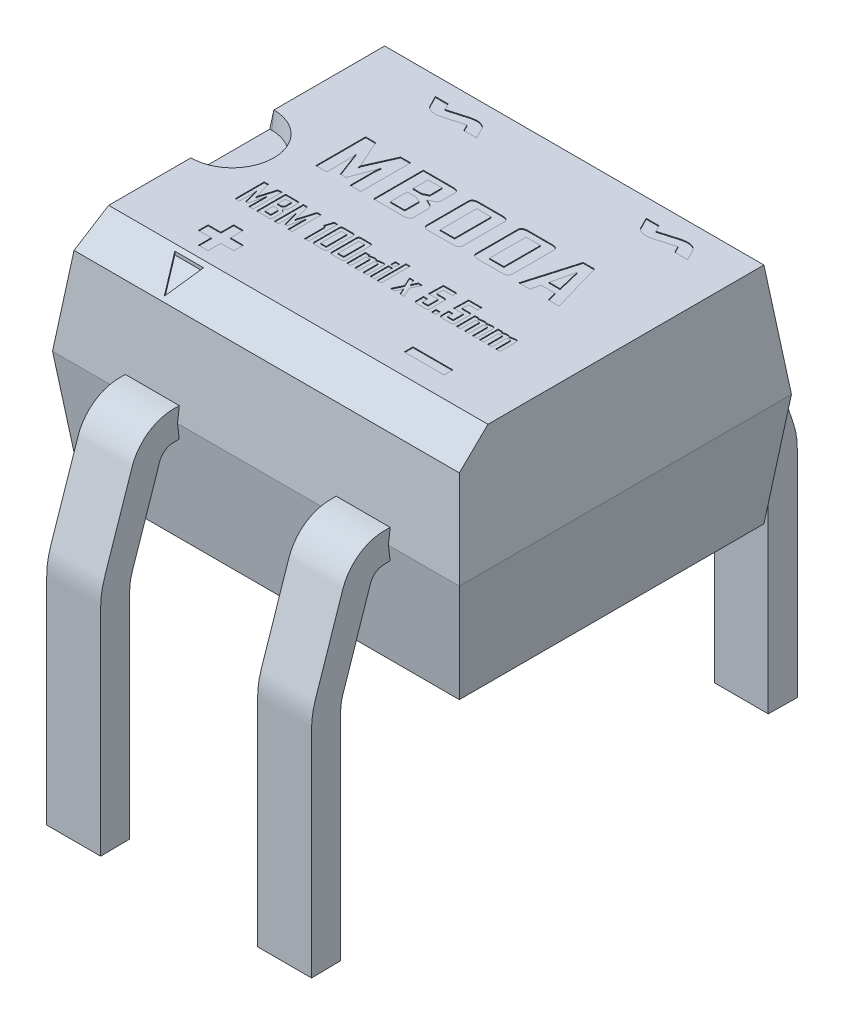
from build123d import *
from OCP.BRepFilletAPI import BRepFilletAPI_MakeChamfer

# Parameters (mm, degrees)
BODY_SKETCH_W                      = 4.9
BODY_SKETCH_H                      = 4
BODY_MAIN_DEPTH                    = 2.7
BODY_CHAMFER1_SIZE                 = 1.35
BODY_CHAMFER1_SIZE2                = 0.165759157
BODY_CHAMFER2_SIZE                 = 0.165759157
BODY_CHAMFER2_SIZE_2               = 1.35
BODY_CHAMFER_SIZE                  = 0.3
BODY_CHAMFER_SIZE2                 = 0.344559539
POLARITY_MARK_DEPTH                = 0.2
POLARITY_MARK_DRAFT                = -7
PIN_B_SKETCH_W                     = 0.65
PIN_B_SKETCH_H                     = 0.35
PIN_PATTERN_COUNT                  = 2
PIN_PATTERN_PITCH                  = 2.54
PIN_PATTERN_MIRROR_COPY_1_SKETCH_W = 0.65
PIN_PATTERN_MIRROR_COPY_1_SKETCH_H = 0.35
TEXT_START                         = 2.79
TEXT_2_OUTLINE_W                   = 0.173493975
TEXT_2_OUTLINE_H                   = 0.440963855
TEXT_2_OUTLINE_W_2                 = 0.173493976
TEXT_2_OUTLINE_W_3                 = 0.067469879
TEXT_2_OUTLINE_H_2                 = 0.248795181
TEXT_2_OUTLINE_W_4                 = 0.06746988
TEXT_2_OUTLINE_W_5                 = 0.050602409
TEXT_2_OUTLINE_H_3                 = 0.054819277
TEXT_2_OUTLINE_W_6                 = 0.05060241
TEXT_2_OUTLINE_H_4                 = 0.35
TEXT_2_OUTLINE_H_5                 = 0.223493976
TEXT_2_OUTLINE_W_7                 = 0.05152485
TEXT_2_DEPTH                       = 0.01
SKETCH23_W                         = 0.481927711
SKETCH23_H                         = 0.106024097
TEXT1_DEPTH                        = 0.01
PIN1_MARK_REACH                    = 10.714


# Read off the part's stored shape, not the designer's step: text
with BuildPart() as part:
    # BODY_Sketch → BODY_MAIN (new body)
    with BuildSketch(Plane(origin=(0, 0.1, 0), x_dir=(1, 0, 0), z_dir=(0, 1, 0))):
        with Locations((1.27, 2.75)):
            Rectangle(BODY_SKETCH_W, BODY_SKETCH_H)
    extrude(amount=BODY_MAIN_DEPTH)

    # BODY_Chamfer1: one chamfer whose edges measure the first distance from different faces: ONE call of the kernel's chamfer builder (chamfer() names one face for all edges)
    body_chamfer1_edges_1 = [part.edges().sort_by_distance(p)[0] for p in [
        (3.72, 2.8, -2.75),
    ]]
    body_chamfer1_side_1 = [part.faces().sort_by_distance(p)[0] for p in [
        (3.72, 1.45, -2.75),
    ]]
    body_chamfer1_edges_2 = [part.edges().sort_by_distance(p)[0] for p in [
        (1.27, 2.8, -4.75),
    ]]
    body_chamfer1_side_2 = [part.faces().sort_by_distance(p)[0] for p in [
        (1.27, 1.45, -4.75),
    ]]
    body_chamfer1_edges_3 = [part.edges().sort_by_distance(p)[0] for p in [
        (-1.18, 2.8, -2.75),
    ]]
    body_chamfer1_side_3 = [part.faces().sort_by_distance(p)[0] for p in [
        (-1.18, 1.45, -2.75),
    ]]
    body_chamfer1_edges_4 = [part.edges().sort_by_distance(p)[0] for p in [
        (1.27, 2.8, -0.75),
    ]]
    body_chamfer1_side_4 = [part.faces().sort_by_distance(p)[0] for p in [
        (1.27, 1.45, -0.75),
    ]]
    body_chamfer1 = BRepFilletAPI_MakeChamfer(part.part.solid().wrapped)
    for e in body_chamfer1_edges_1:
        body_chamfer1.Add(BODY_CHAMFER1_SIZE, BODY_CHAMFER1_SIZE2, e.wrapped, body_chamfer1_side_1[0].wrapped)  # the first distance lies on this face
    for e in body_chamfer1_edges_2:
        body_chamfer1.Add(BODY_CHAMFER1_SIZE, BODY_CHAMFER1_SIZE2, e.wrapped, body_chamfer1_side_2[0].wrapped)  # the first distance lies on this face
    for e in body_chamfer1_edges_3:
        body_chamfer1.Add(BODY_CHAMFER1_SIZE, BODY_CHAMFER1_SIZE2, e.wrapped, body_chamfer1_side_3[0].wrapped)  # the first distance lies on this face
    for e in body_chamfer1_edges_4:
        body_chamfer1.Add(BODY_CHAMFER1_SIZE, BODY_CHAMFER1_SIZE2, e.wrapped, body_chamfer1_side_4[0].wrapped)  # the first distance lies on this face
    add(Compound.cast(body_chamfer1.Shape()), mode=Mode.REPLACE)

    # BODY_Chamfer2
    # the kernel refuses this chamfer: 1.35, 0.165759157 mm, written as the material it takes off along each edge
    with BuildSketch(Plane(origin=(7.2290323, 0.1, -0.75), x_dir=(0, -0.2969684037613583, -0.9548873060039237), z_dir=(-1, 0, 0))) as body_chamfer2_piece_1:
        Polygon((BODY_CHAMFER2_SIZE * 0.954887307265, -BODY_CHAMFER2_SIZE * 0.296968404154), (-BODY_CHAMFER2_SIZE_2 * 0.296968403761, -BODY_CHAMFER2_SIZE_2 * 0.954887306004), (0, 0), align=None)
    extrude(amount=11.918064599, mode=Mode.SUBTRACT)
    with BuildSketch(Plane(origin=(3.72, 0.1, -8.2590323), x_dir=(-0.9548873060039239, -0.2969684037613578, 0), z_dir=(0, 0, 1))) as body_chamfer2_piece_2:
        Polygon((BODY_CHAMFER2_SIZE * 0.954887307265, -BODY_CHAMFER2_SIZE * 0.296968404154), (-BODY_CHAMFER2_SIZE_2 * 0.296968403761, -BODY_CHAMFER2_SIZE_2 * 0.954887306004), (0, 0), align=None)
    extrude(amount=11.018064599, mode=Mode.SUBTRACT)
    with BuildSketch(Plane(origin=(-4.6890323, 0.1, -4.75), x_dir=(0, 0.9999890085715016, -0.004688575069791045), z_dir=(1, 0, 0))) as body_chamfer2_piece_3:
        Polygon((BODY_CHAMFER2_SIZE_2 * 0.999989008572, BODY_CHAMFER2_SIZE_2 * 0.00468857506979), (-BODY_CHAMFER2_SIZE * 0.00468857507598, BODY_CHAMFER2_SIZE * 0.999989009892), (0, 0), align=None)
    extrude(amount=11.918064599, mode=Mode.SUBTRACT)
    with BuildSketch(Plane(origin=(-1.18, 0.1, 2.7590323), x_dir=(-0.004688575069790886, 0.9999890085715016, 0), z_dir=(0, 0, -1))) as body_chamfer2_piece_4:
        Polygon((BODY_CHAMFER2_SIZE_2 * 0.999989008572, BODY_CHAMFER2_SIZE_2 * 0.00468857506979), (-BODY_CHAMFER2_SIZE * 0.00468857507598, BODY_CHAMFER2_SIZE * 0.999989009892), (0, 0), align=None)
    extrude(amount=11.018064599, mode=Mode.SUBTRACT)

    # BODY_Chamfer
    body_chamfer_edges = [part.edges().sort_by_distance(p)[0] for p in [
        (1.27, 2.8, -0.915759157),
    ]]
    body_chamfer_side = [part.faces().sort_by_distance(p)[0] for p in [
        (1.27, 2.117122114, -0.831912296),
    ]]
    chamfer(body_chamfer_edges, length=BODY_CHAMFER_SIZE, length2=BODY_CHAMFER_SIZE2, reference=body_chamfer_side[0])


with BuildPart() as polarity_mark_tool:
    # Sketch24 → Polarity_mark (with draft: the straight prism first)
    with BuildSketch(Plane(origin=(0, 2.8, 0), x_dir=(1, 0, 0), z_dir=(0, 1, 0))):
        with BuildLine():
            ThreePointArc((-1.014240843, 2.25), (-0.514240843, 2.75), (-1.014240843, 3.25))
            Line((-1.014240843, 3.25), (-1.514240843, 3.25))
            Line((-1.514240843, 3.25), (-1.514240843, 2.25))
            Line((-1.514240843, 2.25), (-1.014240843, 2.25))
        make_face()
    extrude(amount=-POLARITY_MARK_DEPTH)
    # Polarity_mark: the draft: its side faces are tilted about the plane it starts from
    polarity_mark_sides = [polarity_mark_tool.faces().sort_by_distance(p)[0] for p in [
        (-0.514240843, 2.7, -2.75),
        (-1.264240843, 2.7, -3.25),
        (-1.514240843, 2.7, -2.75),
        (-1.264240843, 2.7, -2.25),
    ]]
    draft(polarity_mark_sides, Plane(origin=(0, 2.8, 0), x_dir=(1, 0, 0), z_dir=(0, 1, 0)), POLARITY_MARK_DRAFT)


with BuildPart() as part_1:
    add(part.part)

    # Polarity_mark: cut by polarity_mark_tool
    add(polarity_mark_tool.part, mode=Mode.SUBTRACT)

    # PIN: sweep along a path in PIN_B_Path
    with BuildLine(Plane(origin=(0, 0, 0), x_dir=(0, 0, -1), z_dir=(1, 0, 0))) as pin_path:
        Line((0, -2.6), (0, 0))
        ThreePointArc((0, 0), (0.009154664, 0.11283936), (0.036379203, 0.222727273))
        Line((0.036379203, 0.222727273), (0.368189602, 1.211363636))
        ThreePointArc((0.368189602, 1.211363636), (0.495644027, 1.384145449), (0.7, 1.45))
        Line((0.7, 1.45), (2.75, 1.45))
    # PIN_B_Sketch → PIN (sweep)
    with BuildSketch(Plane.XZ.offset(-0.01)):
        Rectangle(PIN_B_SKETCH_W, PIN_B_SKETCH_H)
    pin = sweep(path=pin_path.line)

    # PIN_Pattern: PIN ×2
    with Locations(*[(i * PIN_PATTERN_PITCH, 0, 0) for i in range(1, PIN_PATTERN_COUNT)]):
        add(pin)

    # PIN_Pattern_Mirror: PIN across plane
    add(pin.mirror(Plane.XY.offset(-2.75)))

    # PIN_Pattern_Mirror copy 1: sweep along a path in PIN_Pattern_Mirror copy 1 path
    with BuildLine(Plane(origin=(2.54, 0, -5.5), x_dir=(0, 0, 1), z_dir=(1, 0, 0))) as pin_pattern_mirror_copy_1_path:
        Line((0, 2.6), (0, 0))
        ThreePointArc((0, 0), (0.009154664, -0.11283936), (0.036379203, -0.222727273))
        Line((0.036379203, -0.222727273), (0.368189602, -1.211363636))
        ThreePointArc((0.368189602, -1.211363636), (0.495644027, -1.384145449), (0.7, -1.45))
        Line((0.7, -1.45), (2.75, -1.45))
    # PIN_Pattern_Mirror copy 1 sketch → PIN_Pattern_Mirror copy 1 (sweep)
    with BuildSketch(Plane(origin=(2.54, 0.01, -5.5), x_dir=(1, 0, 0), z_dir=(0, -1, 0))):
        Rectangle(PIN_PATTERN_MIRROR_COPY_1_SKETCH_W, PIN_PATTERN_MIRROR_COPY_1_SKETCH_H)
    sweep(path=pin_pattern_mirror_copy_1_path.line)

    # text 2 outline → text 2 (cut)
    # profile 1 of 21: a face of its own
    with BuildSketch(Plane(origin=(0, 0, 0), x_dir=(1, 0, 0), z_dir=(0, 1, 0)).offset(TEXT_START)):
        with BuildLine():
            add(Edge.make_bspline(
                [(0.231204819, 3.219343023), (0.231291506, 3.223639288), (0.231481335, 3.233047374), (0.233285905, 3.248255928), (0.235705383, 3.265784938), (0.23800289, 3.278161769), (0.239224398, 3.284742119)],
                knots=[0, 0, 0, 0, 0.195301478, 0.427676852, 0.695714808, 1, 1, 1, 1], degree=3))
            Line((0.231204819, 3.219343023), (0.231204819, 2.92227977))
            Line((0.231204819, 2.92227977), (0.361325301, 2.92227977))
            Line((0.361325301, 2.92227977), (0.361325301, 3.52227977))
            Line((0.361325301, 3.52227977), (0.240240964, 3.52227977))
            Line((0.240240964, 3.52227977), (0.09374247, 3.192573444))
            add(Edge.make_bspline(
                [(0.090240964, 3.165465011), (0.090289314, 3.167236598), (0.090394529, 3.171091732), (0.091195478, 3.177371247), (0.092112487, 3.184667989), (0.093177057, 3.189831177), (0.09374247, 3.192573444)],
                knots=[0, 0, 0, 0, 0.19413449, 0.422454333, 0.693254547, 1, 1, 1, 1], degree=3))
            add(Edge.make_bspline(
                [(0.086739458, 3.192573444), (0.087150658, 3.19133919), (0.088177477, 3.188257103), (0.088859566, 3.18241507), (0.089686218, 3.17463068), (0.090042506, 3.168743985), (0.090240964, 3.165465011)],
                knots=[0, 0, 0, 0, 0.142095852, 0.354830918, 0.640631437, 1, 1, 1, 1], degree=3))
            Line((0.086739458, 3.192573444), (-0.059759036, 3.52227977))
            Line((-0.059759036, 3.52227977), (-0.180843373, 3.52227977))
            Line((-0.180843373, 3.52227977), (-0.180843373, 2.92227977))
            Line((-0.180843373, 2.92227977), (-0.050722892, 2.92227977))
            Line((-0.050722892, 2.92227977), (-0.050722892, 3.219343023))
            add(Edge.make_bspline(
                [(-0.058629518, 3.284742119), (-0.057414547, 3.278047897), (-0.055140181, 3.265516636), (-0.052668272, 3.247922949), (-0.051029119, 3.232815329), (-0.050818815, 3.223563143), (-0.050722892, 3.219343023)],
                knots=[0, 0, 0, 0, 0.309420385, 0.579220093, 0.808073296, 1, 1, 1, 1], degree=3))
            Line((-0.058629518, 3.284742119), (0.056694277, 2.980111095))
            Line((0.056694277, 2.980111095), (0.12435241, 2.980111095))
            Line((0.12435241, 2.980111095), (0.239224398, 3.284742119))
        make_face()
    # profile 2 of 21: a face of its own
    with BuildSketch(Plane(origin=(0, 0, 0), x_dir=(1, 0, 0), z_dir=(0, 1, 0)).offset(TEXT_START)):
        with BuildLine():
            add(Edge.make_bspline(
                [(2.672108434, 2.303196824), (2.677709215, 2.304425586), (2.688889827, 2.306878516), (2.700067396, 2.309345274), (2.705645708, 2.310576342)],
                knots=[0, 0, 0, 0, 0.500936953, 1, 1, 1, 1], degree=3))
            Line((2.672108434, 2.303196824), (2.672108434, 2.314793209))
            Line((2.672108434, 2.314793209), (2.621506024, 2.314793209))
            Line((2.621506024, 2.314793209), (2.621506024, 2.091299233))
            Line((2.621506024, 2.091299233), (2.672108434, 2.091299233))
            Line((2.672108434, 2.091299233), (2.672108434, 2.272097426))
            Line((2.672108434, 2.272097426), (2.718493976, 2.272624534))
            Line((2.718493976, 2.272624534), (2.718493976, 2.091299233))
            Line((2.718493976, 2.091299233), (2.769096386, 2.091299233))
            Line((2.769096386, 2.091299233), (2.769096386, 2.272097426))
            Line((2.769096386, 2.272097426), (2.815481928, 2.272624534))
            Line((2.815481928, 2.272624534), (2.815481928, 2.091299233))
            Line((2.815481928, 2.091299233), (2.866084337, 2.091299233))
            Line((2.866084337, 2.091299233), (2.866084337, 2.287185905))
            add(Edge.make_bspline(
                [(2.836566265, 2.314793209), (2.838835885, 2.314687977), (2.843135824, 2.314488607), (2.849150581, 2.313122804), (2.854279159, 2.31086065), (2.858549858, 2.307798736), (2.861904874, 2.303820347), (2.864266395, 2.298978678), (2.865715975, 2.293327858), (2.86595734, 2.289303408), (2.866084337, 2.287185905)],
                knots=[0, 0, 0, 0, 0.148290832, 0.280946377, 0.400455298, 0.512425211, 0.621411208, 0.736958176, 0.861597969, 1, 1, 1, 1], degree=3))
            add(Edge.make_bspline(
                [(2.800261672, 2.309785679), (2.803968788, 2.310535594), (2.810925073, 2.311942786), (2.820699986, 2.313535835), (2.829100539, 2.314536157), (2.834236162, 2.314712981), (2.836566265, 2.314793209)],
                knots=[0, 0, 0, 0, 0.309141697, 0.580094407, 0.809483008, 1, 1, 1, 1], degree=3))
            add(Edge.make_bspline(
                [(2.764418298, 2.302274384), (2.770394395, 2.303493799), (2.782355416, 2.305934432), (2.794289984, 2.308501299), (2.800261672, 2.309785679)],
                knots=[0, 0, 0, 0, 0.499630991, 1, 1, 1, 1], degree=3))
            add(Edge.make_bspline(
                [(2.739578313, 2.314793209), (2.741117691, 2.314759111), (2.744055292, 2.314694042), (2.748256732, 2.314099875), (2.752009951, 2.313113369), (2.755395077, 2.311816661), (2.758323059, 2.310006226), (2.76083295, 2.307825824), (2.762978922, 2.305276366), (2.763932283, 2.303288024), (2.764418298, 2.302274384)],
                knots=[0, 0, 0, 0, 0.156222728, 0.298120382, 0.429540729, 0.5496141, 0.664719661, 0.776938378, 0.886284968, 1, 1, 1, 1], degree=3))
            add(Edge.make_bspline(
                [(2.705645708, 2.310576342), (2.708891156, 2.311220549), (2.715098442, 2.312452668), (2.724026156, 2.313751539), (2.732094033, 2.314616278), (2.737182508, 2.314736571), (2.739578313, 2.314793209)],
                knots=[0, 0, 0, 0, 0.289803378, 0.554281819, 0.790142707, 1, 1, 1, 1], degree=3))
        make_face()
    # profile 3 of 21: a face of its own
    with BuildSketch(Plane(origin=(0, 0, 0), x_dir=(1, 0, 0), z_dir=(0, 1, 0)).offset(TEXT_START)):
        with BuildLine():
            add(Edge.make_bspline(
                [(2.393795181, 2.303196824), (2.399395962, 2.304425586), (2.410576574, 2.306878516), (2.421754143, 2.309345274), (2.427332455, 2.310576342)],
                knots=[0, 0, 0, 0, 0.500936953, 1, 1, 1, 1], degree=3))
            Line((2.393795181, 2.303196824), (2.393795181, 2.314793209))
            Line((2.393795181, 2.314793209), (2.343192771, 2.314793209))
            Line((2.343192771, 2.314793209), (2.343192771, 2.091299233))
            Line((2.343192771, 2.091299233), (2.393795181, 2.091299233))
            Line((2.393795181, 2.091299233), (2.393795181, 2.272097426))
            Line((2.393795181, 2.272097426), (2.440180723, 2.272624534))
            Line((2.440180723, 2.272624534), (2.440180723, 2.091299233))
            Line((2.440180723, 2.091299233), (2.490783133, 2.091299233))
            Line((2.490783133, 2.091299233), (2.490783133, 2.272097426))
            Line((2.490783133, 2.272097426), (2.537168675, 2.272624534))
            Line((2.537168675, 2.272624534), (2.537168675, 2.091299233))
            Line((2.537168675, 2.091299233), (2.587771084, 2.091299233))
            Line((2.587771084, 2.091299233), (2.587771084, 2.287185905))
            add(Edge.make_bspline(
                [(2.558253012, 2.314793209), (2.560522632, 2.314687977), (2.564822571, 2.314488607), (2.570837328, 2.313122804), (2.575965905, 2.31086065), (2.580236605, 2.307798736), (2.583591621, 2.303820347), (2.585953142, 2.298978678), (2.587402722, 2.293327858), (2.587644087, 2.289303408), (2.587771084, 2.287185905)],
                knots=[0, 0, 0, 0, 0.148290832, 0.280946377, 0.400455298, 0.512425211, 0.621411208, 0.736958176, 0.861597969, 1, 1, 1, 1], degree=3))
            add(Edge.make_bspline(
                [(2.521948419, 2.309785679), (2.525655535, 2.310535594), (2.53261182, 2.311942786), (2.542386733, 2.313535835), (2.550787286, 2.314536157), (2.555922909, 2.314712981), (2.558253012, 2.314793209)],
                knots=[0, 0, 0, 0, 0.309141697, 0.580094407, 0.809483008, 1, 1, 1, 1], degree=3))
            add(Edge.make_bspline(
                [(2.486105045, 2.302274384), (2.492081142, 2.303493799), (2.504042163, 2.305934432), (2.515976731, 2.308501299), (2.521948419, 2.309785679)],
                knots=[0, 0, 0, 0, 0.499630991, 1, 1, 1, 1], degree=3))
            add(Edge.make_bspline(
                [(2.46126506, 2.314793209), (2.462804438, 2.314759111), (2.465742039, 2.314694042), (2.469943479, 2.314099875), (2.473696698, 2.313113369), (2.477081824, 2.311816661), (2.480009806, 2.310006226), (2.482519697, 2.307825824), (2.484665669, 2.305276366), (2.485619029, 2.303288024), (2.486105045, 2.302274384)],
                knots=[0, 0, 0, 0, 0.156222728, 0.298120382, 0.429540729, 0.5496141, 0.664719661, 0.776938378, 0.886284968, 1, 1, 1, 1], degree=3))
            add(Edge.make_bspline(
                [(2.427332455, 2.310576342), (2.430577903, 2.311220549), (2.436785189, 2.312452668), (2.445712903, 2.313751539), (2.45378078, 2.314616278), (2.458869255, 2.314736571), (2.46126506, 2.314793209)],
                knots=[0, 0, 0, 0, 0.289803378, 0.554281819, 0.790142707, 1, 1, 1, 1], degree=3))
        make_face()
    # profile 4 of 21: a face of its own
    with BuildSketch(Plane(origin=(0, 0, 0), x_dir=(1, 0, 0), z_dir=(0, 1, 0)).offset(TEXT_START)):
        with BuildLine():
            add(Edge.make_bspline(
                [(2.305240964, 2.118906537), (2.30509211, 2.116809195), (2.304810958, 2.11284779), (2.303319198, 2.107325108), (2.301130324, 2.102522194), (2.297903318, 2.098636879), (2.294018003, 2.095409873), (2.289215089, 2.093220999), (2.283692407, 2.091729239), (2.279731002, 2.091448087), (2.27763366, 2.091299233)],
                knots=[0, 0, 0, 0, 0.143087679, 0.270260174, 0.38817721, 0.5, 0.61182279, 0.729739826, 0.856912321, 1, 1, 1, 1], degree=3))
            Line((2.305240964, 2.118906537), (2.305240964, 2.287185905))
            add(Edge.make_bspline(
                [(2.27763366, 2.314793209), (2.279731002, 2.314644355), (2.283692407, 2.314363203), (2.289215089, 2.312871443), (2.294018003, 2.31068257), (2.297903318, 2.307455563), (2.301130324, 2.303570248), (2.303319198, 2.298767335), (2.304810958, 2.293244652), (2.30509211, 2.289283247), (2.305240964, 2.287185905)],
                knots=[0, 0, 0, 0, 0.143087679, 0.270260174, 0.38817721, 0.5, 0.61182279, 0.729739826, 0.856912321, 1, 1, 1, 1], degree=3))
            Line((2.27763366, 2.314793209), (2.187168675, 2.314793209))
            Line((2.187168675, 2.314793209), (2.191385542, 2.390696824))
            Line((2.191385542, 2.390696824), (2.301024096, 2.390696824))
            Line((2.301024096, 2.390696824), (2.301024096, 2.441299233))
            Line((2.301024096, 2.441299233), (2.140783133, 2.441299233))
            Line((2.140783133, 2.441299233), (2.136566265, 2.264190799))
            Line((2.136566265, 2.264190799), (2.254638554, 2.264190799))
            Line((2.254638554, 2.264190799), (2.254638554, 2.141901643))
            Line((2.254638554, 2.141901643), (2.187168675, 2.141901643))
            Line((2.187168675, 2.141901643), (2.187168675, 2.205154655))
            Line((2.187168675, 2.205154655), (2.136566265, 2.205154655))
            Line((2.136566265, 2.205154655), (2.136566265, 2.118906537))
            add(Edge.make_bspline(
                [(2.164173569, 2.091299233), (2.162076227, 2.091448087), (2.158114822, 2.091729239), (2.15259214, 2.093220999), (2.147789226, 2.095409873), (2.143903911, 2.098636879), (2.140676905, 2.102522194), (2.138488031, 2.107325108), (2.136996271, 2.11284779), (2.136715119, 2.116809195), (2.136566265, 2.118906537)],
                knots=[0, 0, 0, 0, 0.143087679, 0.270260174, 0.38817721, 0.5, 0.61182279, 0.729739826, 0.856912321, 1, 1, 1, 1], degree=3))
            Line((2.164173569, 2.091299233), (2.27763366, 2.091299233))
        make_face()
    # profile 5 of 21: a face of its own
    with BuildSketch(Plane(origin=(0, 0, 0), x_dir=(1, 0, 0), z_dir=(0, 1, 0)).offset(TEXT_START)):
        with BuildLine():
            add(Edge.make_bspline(
                [(0.947590361, 2.969606577), (0.947284445, 2.965991116), (0.946697697, 2.959056662), (0.942851845, 2.949475874), (0.937128947, 2.941175697), (0.928968547, 2.934577764), (0.918959227, 2.929185858), (0.906787123, 2.92550327), (0.892641498, 2.923015525), (0.882504615, 2.922535371), (0.877108434, 2.92227977)],
                knots=[0, 0, 0, 0, 0.114098337, 0.218840581, 0.322174175, 0.429434412, 0.547100708, 0.679564678, 0.829422238, 1, 1, 1, 1], degree=3))
            Line((0.947590361, 2.969606577), (0.947590361, 3.144455975))
            add(Edge.make_bspline(
                [(0.917658133, 3.199237601), (0.920038354, 3.197563369), (0.924708631, 3.194278328), (0.930770246, 3.188493292), (0.935972486, 3.182283231), (0.940250262, 3.175659332), (0.943638946, 3.16853815), (0.945792566, 3.160889786), (0.947387523, 3.152842272), (0.947521859, 3.147288189), (0.947590361, 3.144455975)],
                knots=[0, 0, 0, 0, 0.133657493, 0.26225178, 0.383948145, 0.505447312, 0.623949121, 0.745003415, 0.869968602, 1, 1, 1, 1], degree=3))
            add(Edge.make_bspline(
                [(0.847628012, 3.233123143), (0.852816926, 3.230661378), (0.862510404, 3.226062521), (0.876199385, 3.21982837), (0.887743229, 3.214026587), (0.897592556, 3.209600305), (0.905257842, 3.20557222), (0.911213636, 3.202876453), (0.915091755, 3.20076116), (0.917019601, 3.199616672), (0.917658133, 3.199237601)],
                knots=[0, 0, 0, 0, 0.221425396, 0.413647727, 0.579844793, 0.719452514, 0.829810176, 0.913562231, 0.971370526, 1, 1, 1, 1], degree=3))
            add(Edge.make_bspline(
                [(0.915286145, 3.265653264), (0.914649465, 3.265270694), (0.912814472, 3.264168079), (0.909022669, 3.2622882), (0.903352458, 3.259589421), (0.895812028, 3.255994871), (0.886413488, 3.251448001), (0.875164204, 3.246046438), (0.862034317, 3.239811984), (0.852639141, 3.235449808), (0.847628012, 3.233123143)],
                knots=[0, 0, 0, 0, 0.029670614, 0.085514592, 0.168948945, 0.280647032, 0.419252386, 0.586121092, 0.779248325, 1, 1, 1, 1], degree=3))
            add(Edge.make_bspline(
                [(0.943072289, 3.31794995), (0.942976655, 3.315198362), (0.942790913, 3.309854219), (0.941601679, 3.302038025), (0.939226416, 3.294823084), (0.936371126, 3.287892996), (0.932310973, 3.281592697), (0.927579595, 3.275644916), (0.921844518, 3.270280194), (0.917508997, 3.267221486), (0.915286145, 3.265653264)],
                knots=[0, 0, 0, 0, 0.13337718, 0.259045492, 0.38137207, 0.500668247, 0.621144296, 0.743089369, 0.868280056, 1, 1, 1, 1], degree=3))
            Line((0.943072289, 3.31794995), (0.943072289, 3.474952962))
            add(Edge.make_bspline(
                [(0.874849398, 3.52227977), (0.88005801, 3.522024163), (0.889859295, 3.521543176), (0.903550732, 3.51904247), (0.915364691, 3.515383414), (0.925046361, 3.509945713), (0.932975239, 3.503375534), (0.938442993, 3.495038082), (0.942158061, 3.485483864), (0.942758581, 3.478566539), (0.943072289, 3.474952962)],
                knots=[0, 0, 0, 0, 0.168128508, 0.316375143, 0.448176834, 0.565139626, 0.672821552, 0.776962353, 0.883486227, 1, 1, 1, 1], degree=3))
            Line((0.874849398, 3.52227977), (0.513855422, 3.52227977))
            Line((0.513855422, 3.52227977), (0.513855422, 2.92227977))
            Line((0.513855422, 2.92227977), (0.877108434, 2.92227977))
        make_face()
        Polygon((0.643975904, 2.994568926), (0.643975904, 3.196978565), (0.751054217, 3.196978565), (0.81746988, 3.167498143), (0.81746988, 2.994568926), align=None, mode=Mode.SUBTRACT)
        Polygon((0.812951807, 3.300781276), (0.748795181, 3.269267722), (0.643975904, 3.269267722), (0.643975904, 3.449990613), (0.812951807, 3.449990613), align=None, mode=Mode.SUBTRACT)
    # profile 6 of 21: a face of its own
    with BuildSketch(Plane(origin=(0, 0, 0), x_dir=(1, 0, 0), z_dir=(0, 1, 0)).offset(TEXT_START)):
        with BuildLine():
            add(Edge.make_bspline(
                [(1.541084337, 2.969606577), (1.540778421, 2.965991116), (1.540191673, 2.959056662), (1.536345821, 2.949475874), (1.530622923, 2.941175697), (1.522462523, 2.934577764), (1.512453203, 2.929185858), (1.500281099, 2.92550327), (1.486135474, 2.923015525), (1.47599859, 2.922535371), (1.47060241, 2.92227977)],
                knots=[0, 0, 0, 0, 0.114098337, 0.218840581, 0.322174175, 0.429434412, 0.547100708, 0.679564678, 0.829422238, 1, 1, 1, 1], degree=3))
            Line((1.541084337, 2.969606577), (1.541084337, 3.474952962))
            add(Edge.make_bspline(
                [(1.47060241, 3.52227977), (1.47599859, 3.522024169), (1.486135474, 3.521544015), (1.500281099, 3.51905627), (1.512453203, 3.515373681), (1.522462523, 3.509981776), (1.530622923, 3.503383842), (1.536345821, 3.495083665), (1.540191673, 3.485502877), (1.540778421, 3.478568424), (1.541084337, 3.474952962)],
                knots=[0, 0, 0, 0, 0.170577762, 0.320435322, 0.452899292, 0.570565588, 0.677825825, 0.781159419, 0.885901663, 1, 1, 1, 1], degree=3))
            Line((1.47060241, 3.52227977), (1.179525602, 3.52227977))
            add(Edge.make_bspline(
                [(1.107349398, 3.474952962), (1.107645074, 3.478572224), (1.108213317, 3.485527875), (1.112216909, 3.495089628), (1.118048141, 3.50342938), (1.126444185, 3.509977645), (1.136665695, 3.515371701), (1.149130782, 3.51908346), (1.163620901, 3.521528426), (1.174017458, 3.522019563), (1.179525602, 3.52227977)],
                knots=[0, 0, 0, 0, 0.112348161, 0.215915455, 0.318343111, 0.425762474, 0.543690884, 0.676356302, 0.828532073, 1, 1, 1, 1], degree=3))
            Line((1.107349398, 3.474952962), (1.107349398, 2.969606577))
            add(Edge.make_bspline(
                [(1.177831325, 2.92227977), (1.172435145, 2.922535371), (1.162298261, 2.923015525), (1.148152636, 2.92550327), (1.135980532, 2.929185858), (1.125971212, 2.934577764), (1.117810812, 2.941175697), (1.112087914, 2.949475874), (1.108242062, 2.959056662), (1.107655314, 2.965991116), (1.107349398, 2.969606577)],
                knots=[0, 0, 0, 0, 0.170577762, 0.320435322, 0.452899292, 0.570565588, 0.677825825, 0.781159419, 0.885901663, 1, 1, 1, 1], degree=3))
            Line((1.177831325, 2.92227977), (1.47060241, 2.92227977))
        make_face()
        with Locations((1.324216868, 3.22227977)):
            Rectangle(TEXT_2_OUTLINE_W, TEXT_2_OUTLINE_H, mode=Mode.SUBTRACT)
    # profile 7 of 21: a face of its own
    with BuildSketch(Plane(origin=(0, 0, 0), x_dir=(1, 0, 0), z_dir=(0, 1, 0)).offset(TEXT_START)):
        with BuildLine():
            add(Edge.make_bspline(
                [(2.134578313, 2.969606577), (2.134272397, 2.965991116), (2.133685649, 2.959056662), (2.129839797, 2.949475874), (2.124116899, 2.941175697), (2.115956499, 2.934577764), (2.105947179, 2.929185858), (2.093775075, 2.92550327), (2.07962945, 2.923015525), (2.069492566, 2.922535371), (2.064096386, 2.92227977)],
                knots=[0, 0, 0, 0, 0.114098337, 0.218840581, 0.322174175, 0.429434412, 0.547100708, 0.679564678, 0.829422238, 1, 1, 1, 1], degree=3))
            Line((2.134578313, 2.969606577), (2.134578313, 3.474952962))
            add(Edge.make_bspline(
                [(2.064096386, 3.52227977), (2.069492566, 3.522024169), (2.07962945, 3.521544015), (2.093775075, 3.51905627), (2.105947179, 3.515373681), (2.115956499, 3.509981776), (2.124116899, 3.503383842), (2.129839797, 3.495083665), (2.133685649, 3.485502877), (2.134272397, 3.478568424), (2.134578313, 3.474952962)],
                knots=[0, 0, 0, 0, 0.170577762, 0.320435322, 0.452899292, 0.570565588, 0.677825825, 0.781159419, 0.885901663, 1, 1, 1, 1], degree=3))
            Line((2.064096386, 3.52227977), (1.773019578, 3.52227977))
            add(Edge.make_bspline(
                [(1.700843373, 3.474952962), (1.70113905, 3.478572224), (1.701707293, 3.485527875), (1.705710885, 3.495089628), (1.711542117, 3.50342938), (1.719938161, 3.509977645), (1.73015967, 3.515371701), (1.742624758, 3.51908346), (1.757114877, 3.521528426), (1.767511434, 3.522019563), (1.773019578, 3.52227977)],
                knots=[0, 0, 0, 0, 0.112348161, 0.215915455, 0.318343111, 0.425762474, 0.543690884, 0.676356302, 0.828532073, 1, 1, 1, 1], degree=3))
            Line((1.700843373, 3.474952962), (1.700843373, 2.969606577))
            add(Edge.make_bspline(
                [(1.771325301, 2.92227977), (1.76592912, 2.922535371), (1.755792237, 2.923015525), (1.741646612, 2.92550327), (1.729474508, 2.929185858), (1.719465188, 2.934577764), (1.711304788, 2.941175697), (1.70558189, 2.949475874), (1.701736038, 2.959056662), (1.70114929, 2.965991116), (1.700843373, 2.969606577)],
                knots=[0, 0, 0, 0, 0.170577762, 0.320435322, 0.452899292, 0.570565588, 0.677825825, 0.781159419, 0.885901663, 1, 1, 1, 1], degree=3))
            Line((1.771325301, 2.92227977), (2.064096386, 2.92227977))
        make_face()
        with Locations((1.917710843, 3.22227977)):
            Rectangle(TEXT_2_OUTLINE_W_2, TEXT_2_OUTLINE_H, mode=Mode.SUBTRACT)
    # profile 8 of 21: a face of its own
    with BuildSketch(Plane(origin=(0, 0, 0), x_dir=(1, 0, 0), z_dir=(0, 1, 0)).offset(TEXT_START)):
        with BuildLine():
            add(Edge.make_bspline(
                [(-0.157409639, 2.264586131), (-0.157365916, 2.267090873), (-0.157270321, 2.272567312), (-0.156598736, 2.281439245), (-0.155723913, 2.291663392), (-0.154802312, 2.298895066), (-0.154312877, 2.302735604)],
                knots=[0, 0, 0, 0, 0.196205167, 0.428988559, 0.69675201, 1, 1, 1, 1], degree=3))
            Line((-0.157409639, 2.264586131), (-0.157409639, 2.091299233))
            Line((-0.157409639, 2.091299233), (-0.106807229, 2.091299233))
            Line((-0.106807229, 2.091299233), (-0.106807229, 2.441299233))
            Line((-0.106807229, 2.441299233), (-0.156355422, 2.441299233))
            Line((-0.156355422, 2.441299233), (-0.21295369, 2.248970543))
            add(Edge.make_bspline(
                [(-0.214337349, 2.23315729), (-0.214326502, 2.234189989), (-0.214302931, 2.236434083), (-0.214006036, 2.240103979), (-0.213537045, 2.244340312), (-0.213155624, 2.247367738), (-0.21295369, 2.248970543)],
                knots=[0, 0, 0, 0, 0.194996564, 0.423734939, 0.69490896, 1, 1, 1, 1], degree=3))
            add(Edge.make_bspline(
                [(-0.215721009, 2.248970543), (-0.215550612, 2.248248387), (-0.21512137, 2.24642923), (-0.214917945, 2.243038688), (-0.214536887, 2.238500582), (-0.214408757, 2.235069471), (-0.214337349, 2.23315729)],
                knots=[0, 0, 0, 0, 0.139830187, 0.352241267, 0.63899967, 1, 1, 1, 1], degree=3))
            Line((-0.215721009, 2.248970543), (-0.272319277, 2.441299233))
            Line((-0.272319277, 2.441299233), (-0.32186747, 2.441299233))
            Line((-0.32186747, 2.441299233), (-0.32186747, 2.091299233))
            Line((-0.32186747, 2.091299233), (-0.27126506, 2.091299233))
            Line((-0.27126506, 2.091299233), (-0.27126506, 2.264586131))
            add(Edge.make_bspline(
                [(-0.274427711, 2.302735604), (-0.273947898, 2.298828222), (-0.273048546, 2.291504294), (-0.272066062, 2.281244755), (-0.271407929, 2.272435357), (-0.27130985, 2.267046866), (-0.27126506, 2.264586131)],
                knots=[0, 0, 0, 0, 0.308334773, 0.577937301, 0.807258736, 1, 1, 1, 1], degree=3))
            Line((-0.274427711, 2.302735604), (-0.227910392, 2.125034173))
            Line((-0.227910392, 2.125034173), (-0.200566642, 2.125034173))
            Line((-0.200566642, 2.125034173), (-0.154312877, 2.302735604))
        make_face()
    # profile 9 of 21: a face of its own
    with BuildSketch(Plane(origin=(0, 0, 0), x_dir=(1, 0, 0), z_dir=(0, 1, 0)).offset(TEXT_START)):
        with BuildLine():
            add(Edge.make_bspline(
                [(0.108253012, 2.118906537), (0.108104158, 2.116809195), (0.107823006, 2.11284779), (0.106331246, 2.107325108), (0.104142373, 2.102522194), (0.100915366, 2.098636879), (0.097030051, 2.095409873), (0.092227138, 2.093220999), (0.086704455, 2.091729239), (0.08274305, 2.091448087), (0.080645708, 2.091299233)],
                knots=[0, 0, 0, 0, 0.143087679, 0.270260174, 0.38817721, 0.5, 0.61182279, 0.729739826, 0.856912321, 1, 1, 1, 1], degree=3))
            Line((0.108253012, 2.118906537), (0.108253012, 2.216685152))
            add(Edge.make_bspline(
                [(0.096590738, 2.248641101), (0.098381025, 2.24657968), (0.101994391, 2.242419081), (0.105675469, 2.234750172), (0.107894179, 2.22605704), (0.108129678, 2.219906356), (0.108253012, 2.216685152)],
                knots=[0, 0, 0, 0, 0.233880582, 0.472044868, 0.723502121, 1, 1, 1, 1], degree=3))
            add(Edge.make_bspline(
                [(0.069444654, 2.268407667), (0.071459556, 2.266972133), (0.075221178, 2.264292133), (0.08057577, 2.260652975), (0.084985722, 2.257265752), (0.08885765, 2.254680158), (0.091776783, 2.2523315), (0.094145204, 2.250760864), (0.095627558, 2.249526289), (0.09635035, 2.248862023), (0.096590738, 2.248641101)],
                knots=[0, 0, 0, 0, 0.220942432, 0.412477611, 0.578026926, 0.717341328, 0.827964795, 0.912327655, 0.970841742, 1, 1, 1, 1], degree=3))
            add(Edge.make_bspline(
                [(0.095734187, 2.28738357), (0.095496398, 2.287159318), (0.094801128, 2.286503629), (0.093264116, 2.285462327), (0.091082396, 2.283842699), (0.088169292, 2.281721615), (0.084491431, 2.279131143), (0.080152624, 2.275915354), (0.075018364, 2.272345783), (0.07137554, 2.269771939), (0.069444654, 2.268407667)],
                knots=[0, 0, 0, 0, 0.03020373, 0.088312421, 0.171215672, 0.28175334, 0.42157366, 0.587380162, 0.781289977, 1, 1, 1, 1], degree=3))
            add(Edge.make_bspline(
                [(0.106474021, 2.317889971), (0.106371703, 2.31477788), (0.106176865, 2.308851753), (0.104053205, 2.300536825), (0.100789468, 2.293187886), (0.097396075, 2.289291699), (0.095734187, 2.28738357)],
                knots=[0, 0, 0, 0, 0.28088772, 0.534874023, 0.772208062, 1, 1, 1, 1], degree=3))
            Line((0.106474021, 2.317889971), (0.106474021, 2.413691929))
            add(Edge.make_bspline(
                [(0.079723268, 2.441299233), (0.081753647, 2.441147192), (0.085604393, 2.440858835), (0.090971664, 2.439400327), (0.095597943, 2.437139624), (0.099420969, 2.434006235), (0.10239804, 2.430003529), (0.10464915, 2.425293993), (0.106016698, 2.41973581), (0.106315565, 2.41578605), (0.106474021, 2.413691929)],
                knots=[0, 0, 0, 0, 0.140831718, 0.267096601, 0.382794658, 0.495223805, 0.606013682, 0.725812601, 0.85462873, 1, 1, 1, 1], degree=3))
            Line((0.079723268, 2.441299233), (-0.064638554, 2.441299233))
            Line((-0.064638554, 2.441299233), (-0.064638554, 2.091299233))
            Line((-0.064638554, 2.091299233), (0.080645708, 2.091299233))
        make_face()
        Polygon((0.057650602, 2.141901643), (-0.014036145, 2.141901643), (-0.014036145, 2.243106462), (0.031624623, 2.243106462), (0.057650602, 2.228347426), align=None, mode=Mode.SUBTRACT)
        Polygon((-0.014036145, 2.390696824), (0.055871611, 2.390696824), (0.055871611, 2.31064223), (0.030768072, 2.293708872), (-0.014036145, 2.293708872), align=None, mode=Mode.SUBTRACT)
    # profile 10 of 21: a face of its own
    with BuildSketch(Plane(origin=(0, 0, 0), x_dir=(1, 0, 0), z_dir=(0, 1, 0)).offset(TEXT_START)):
        with BuildLine():
            add(Edge.make_bspline(
                [(0.314879518, 2.264586131), (0.31492324, 2.267090873), (0.315018835, 2.272567312), (0.315690421, 2.281439245), (0.316565244, 2.291663392), (0.317486844, 2.298895066), (0.31797628, 2.302735604)],
                knots=[0, 0, 0, 0, 0.196205167, 0.428988559, 0.69675201, 1, 1, 1, 1], degree=3))
            Line((0.314879518, 2.264586131), (0.314879518, 2.091299233))
            Line((0.314879518, 2.091299233), (0.365481928, 2.091299233))
            Line((0.365481928, 2.091299233), (0.365481928, 2.441299233))
            Line((0.365481928, 2.441299233), (0.315933735, 2.441299233))
            Line((0.315933735, 2.441299233), (0.259335467, 2.248970543))
            add(Edge.make_bspline(
                [(0.257951807, 2.23315729), (0.257962655, 2.234189989), (0.257986226, 2.236434083), (0.258283121, 2.240103979), (0.258752112, 2.244340312), (0.259133532, 2.247367738), (0.259335467, 2.248970543)],
                knots=[0, 0, 0, 0, 0.194996564, 0.423734939, 0.69490896, 1, 1, 1, 1], degree=3))
            add(Edge.make_bspline(
                [(0.256568148, 2.248970543), (0.256738545, 2.248248387), (0.257167787, 2.24642923), (0.257371212, 2.243038688), (0.257752269, 2.238500582), (0.257880399, 2.235069471), (0.257951807, 2.23315729)],
                knots=[0, 0, 0, 0, 0.139830187, 0.352241267, 0.63899967, 1, 1, 1, 1], degree=3))
            Line((0.256568148, 2.248970543), (0.19996988, 2.441299233))
            Line((0.19996988, 2.441299233), (0.150421687, 2.441299233))
            Line((0.150421687, 2.441299233), (0.150421687, 2.091299233))
            Line((0.150421687, 2.091299233), (0.201024096, 2.091299233))
            Line((0.201024096, 2.091299233), (0.201024096, 2.264586131))
            add(Edge.make_bspline(
                [(0.197861446, 2.302735604), (0.198341259, 2.298828222), (0.199240611, 2.291504294), (0.200223095, 2.281244755), (0.200881227, 2.272435357), (0.200979307, 2.267046866), (0.201024096, 2.264586131)],
                knots=[0, 0, 0, 0, 0.308334773, 0.577937301, 0.807258736, 1, 1, 1, 1], degree=3))
            Line((0.197861446, 2.302735604), (0.244378765, 2.125034173))
            Line((0.244378765, 2.125034173), (0.271722515, 2.125034173))
            Line((0.271722515, 2.125034173), (0.31797628, 2.302735604))
        make_face()
    # profile 11 of 21: a face of its own
    with BuildSketch(Plane(origin=(0, 0, 0), x_dir=(1, 0, 0), z_dir=(0, 1, 0)).offset(TEXT_START)):
        with BuildLine():
            add(Edge.make_bspline(
                [(2.001626506, 2.118906537), (2.001477652, 2.116809195), (2.0011965, 2.11284779), (1.99970474, 2.107325108), (1.997515866, 2.102522194), (1.99428886, 2.098636879), (1.990403545, 2.095409873), (1.985600632, 2.093220999), (1.980077949, 2.091729239), (1.976116544, 2.091448087), (1.974019202, 2.091299233)],
                knots=[0, 0, 0, 0, 0.143087679, 0.270260174, 0.38817721, 0.5, 0.61182279, 0.729739826, 0.856912321, 1, 1, 1, 1], degree=3))
            Line((2.001626506, 2.118906537), (2.001626506, 2.287185905))
            add(Edge.make_bspline(
                [(1.974019202, 2.314793209), (1.976116544, 2.314644355), (1.980077949, 2.314363203), (1.985600632, 2.312871443), (1.990403545, 2.31068257), (1.99428886, 2.307455563), (1.997515866, 2.303570248), (1.99970474, 2.298767335), (2.0011965, 2.293244652), (2.001477652, 2.289283247), (2.001626506, 2.287185905)],
                knots=[0, 0, 0, 0, 0.143087679, 0.270260174, 0.38817721, 0.5, 0.61182279, 0.729739826, 0.856912321, 1, 1, 1, 1], degree=3))
            Line((1.974019202, 2.314793209), (1.883554217, 2.314793209))
            Line((1.883554217, 2.314793209), (1.887771084, 2.390696824))
            Line((1.887771084, 2.390696824), (1.997409639, 2.390696824))
            Line((1.997409639, 2.390696824), (1.997409639, 2.441299233))
            Line((1.997409639, 2.441299233), (1.837168675, 2.441299233))
            Line((1.837168675, 2.441299233), (1.832951807, 2.264190799))
            Line((1.832951807, 2.264190799), (1.951024096, 2.264190799))
            Line((1.951024096, 2.264190799), (1.951024096, 2.141901643))
            Line((1.951024096, 2.141901643), (1.883554217, 2.141901643))
            Line((1.883554217, 2.141901643), (1.883554217, 2.205154655))
            Line((1.883554217, 2.205154655), (1.832951807, 2.205154655))
            Line((1.832951807, 2.205154655), (1.832951807, 2.118906537))
            add(Edge.make_bspline(
                [(1.860559111, 2.091299233), (1.858461769, 2.091448087), (1.854500364, 2.091729239), (1.848977682, 2.093220999), (1.844174768, 2.095409873), (1.840289454, 2.098636879), (1.837062447, 2.102522194), (1.834873573, 2.107325108), (1.833381813, 2.11284779), (1.833100661, 2.116809195), (1.832951807, 2.118906537)],
                knots=[0, 0, 0, 0, 0.143087679, 0.270260174, 0.38817721, 0.5, 0.61182279, 0.729739826, 0.856912321, 1, 1, 1, 1], degree=3))
            Line((1.860559111, 2.091299233), (1.974019202, 2.091299233))
        make_face()
    # profile 12 of 21: a face of its own
    with BuildSketch(Plane(origin=(0, 0, 0), x_dir=(1, 0, 0), z_dir=(0, 1, 0)).offset(TEXT_START)):
        with BuildLine():
            add(Edge.make_bspline(
                [(1.073915663, 2.303196824), (1.079516444, 2.304425586), (1.090697056, 2.306878516), (1.101874625, 2.309345274), (1.107452937, 2.310576342)],
                knots=[0, 0, 0, 0, 0.500936953, 1, 1, 1, 1], degree=3))
            Line((1.073915663, 2.303196824), (1.073915663, 2.314793209))
            Line((1.073915663, 2.314793209), (1.023313253, 2.314793209))
            Line((1.023313253, 2.314793209), (1.023313253, 2.091299233))
            Line((1.023313253, 2.091299233), (1.073915663, 2.091299233))
            Line((1.073915663, 2.091299233), (1.073915663, 2.272097426))
            Line((1.073915663, 2.272097426), (1.120301205, 2.272624534))
            Line((1.120301205, 2.272624534), (1.120301205, 2.091299233))
            Line((1.120301205, 2.091299233), (1.170903614, 2.091299233))
            Line((1.170903614, 2.091299233), (1.170903614, 2.272097426))
            Line((1.170903614, 2.272097426), (1.217289157, 2.272624534))
            Line((1.217289157, 2.272624534), (1.217289157, 2.091299233))
            Line((1.217289157, 2.091299233), (1.267891566, 2.091299233))
            Line((1.267891566, 2.091299233), (1.267891566, 2.287185905))
            add(Edge.make_bspline(
                [(1.238373494, 2.314793209), (1.240643114, 2.314687977), (1.244943052, 2.314488607), (1.25095781, 2.313122804), (1.256086387, 2.31086065), (1.260357087, 2.307798736), (1.263712103, 2.303820347), (1.266073624, 2.298978678), (1.267523204, 2.293327858), (1.267764569, 2.289303408), (1.267891566, 2.287185905)],
                knots=[0, 0, 0, 0, 0.148290832, 0.280946377, 0.400455298, 0.512425211, 0.621411208, 0.736958176, 0.861597969, 1, 1, 1, 1], degree=3))
            add(Edge.make_bspline(
                [(1.202068901, 2.309785679), (1.205776017, 2.310535594), (1.212732302, 2.311942786), (1.222507215, 2.313535835), (1.230907768, 2.314536157), (1.236043391, 2.314712981), (1.238373494, 2.314793209)],
                knots=[0, 0, 0, 0, 0.309141697, 0.580094407, 0.809483008, 1, 1, 1, 1], degree=3))
            add(Edge.make_bspline(
                [(1.166225527, 2.302274384), (1.172201624, 2.303493799), (1.184162645, 2.305934432), (1.196097213, 2.308501299), (1.202068901, 2.309785679)],
                knots=[0, 0, 0, 0, 0.499630991, 1, 1, 1, 1], degree=3))
            add(Edge.make_bspline(
                [(1.141385542, 2.314793209), (1.14292492, 2.314759111), (1.145862521, 2.314694042), (1.150063961, 2.314099875), (1.15381718, 2.313113369), (1.157202306, 2.311816661), (1.160130288, 2.310006226), (1.162640179, 2.307825824), (1.164786151, 2.305276366), (1.165739511, 2.303288024), (1.166225527, 2.302274384)],
                knots=[0, 0, 0, 0, 0.156222728, 0.298120382, 0.429540729, 0.5496141, 0.664719661, 0.776938378, 0.886284968, 1, 1, 1, 1], degree=3))
            add(Edge.make_bspline(
                [(1.107452937, 2.310576342), (1.110698384, 2.311220549), (1.116905671, 2.312452668), (1.125833385, 2.313751539), (1.133901262, 2.314616278), (1.138989737, 2.314736571), (1.141385542, 2.314793209)],
                knots=[0, 0, 0, 0, 0.289803378, 0.554281819, 0.790142707, 1, 1, 1, 1], degree=3))
        make_face()
    # profile 13 of 21: a face of its own
    with BuildSketch(Plane(origin=(0, 0, 0), x_dir=(1, 0, 0), z_dir=(0, 1, 0)).offset(TEXT_START)):
        with BuildLine():
            add(Edge.make_bspline(
                [(0.985361446, 2.118906537), (0.985212592, 2.116809195), (0.98493144, 2.11284779), (0.98343968, 2.107325108), (0.981250806, 2.102522194), (0.978023799, 2.098636879), (0.974138485, 2.095409873), (0.969335571, 2.093220999), (0.963812889, 2.091729239), (0.959851484, 2.091448087), (0.957754142, 2.091299233)],
                knots=[0, 0, 0, 0, 0.143087679, 0.270260174, 0.38817721, 0.5, 0.61182279, 0.729739826, 0.856912321, 1, 1, 1, 1], degree=3))
            Line((0.985361446, 2.118906537), (0.985361446, 2.413691929))
            add(Edge.make_bspline(
                [(0.957754142, 2.441299233), (0.959851484, 2.441150379), (0.963812889, 2.440869227), (0.969335571, 2.439377467), (0.974138485, 2.437188594), (0.978023799, 2.433961587), (0.981250806, 2.430076273), (0.98343968, 2.425273359), (0.98493144, 2.419750676), (0.985212592, 2.415789272), (0.985361446, 2.413691929)],
                knots=[0, 0, 0, 0, 0.143087679, 0.270260174, 0.38817721, 0.5, 0.61182279, 0.729739826, 0.856912321, 1, 1, 1, 1], degree=3))
            Line((0.957754142, 2.441299233), (0.845018825, 2.441299233))
            add(Edge.make_bspline(
                [(0.816686747, 2.413691929), (0.816829155, 2.415790792), (0.817098526, 2.419760881), (0.818677895, 2.425278943), (0.820930436, 2.430083352), (0.824226565, 2.433963413), (0.828190151, 2.437207912), (0.833133018, 2.439386551), (0.838810269, 2.44086022), (0.842878233, 2.44114787), (0.845018825, 2.441299233)],
                knots=[0, 0, 0, 0, 0.141223278, 0.267129934, 0.384156657, 0.495459119, 0.606977379, 0.726031612, 0.85583585, 1, 1, 1, 1], degree=3))
            Line((0.816686747, 2.413691929), (0.816686747, 2.118906537))
            add(Edge.make_bspline(
                [(0.844294051, 2.091299233), (0.842196709, 2.091448087), (0.838235304, 2.091729239), (0.832712621, 2.093220999), (0.827909708, 2.095409873), (0.824024393, 2.098636879), (0.820797387, 2.102522194), (0.818608513, 2.107325108), (0.817116753, 2.11284779), (0.816835601, 2.116809195), (0.816686747, 2.118906537)],
                knots=[0, 0, 0, 0, 0.143087679, 0.270260174, 0.38817721, 0.5, 0.61182279, 0.729739826, 0.856912321, 1, 1, 1, 1], degree=3))
            Line((0.844294051, 2.091299233), (0.957754142, 2.091299233))
        make_face()
        with Locations((0.901024097, 2.266299233)):
            Rectangle(TEXT_2_OUTLINE_W_3, TEXT_2_OUTLINE_H_2, mode=Mode.SUBTRACT)
    # profile 14 of 21: a face of its own
    with BuildSketch(Plane(origin=(0, 0, 0), x_dir=(1, 0, 0), z_dir=(0, 1, 0)).offset(TEXT_START)):
        with BuildLine():
            add(Edge.make_bspline(
                [(0.774518072, 2.118906537), (0.774369218, 2.116809195), (0.774088066, 2.11284779), (0.772596307, 2.107325108), (0.770407433, 2.102522194), (0.767180426, 2.098636879), (0.763295112, 2.095409873), (0.758492198, 2.093220999), (0.752969515, 2.091729239), (0.749008111, 2.091448087), (0.746910768, 2.091299233)],
                knots=[0, 0, 0, 0, 0.143087679, 0.270260174, 0.38817721, 0.5, 0.61182279, 0.729739826, 0.856912321, 1, 1, 1, 1], degree=3))
            Line((0.774518072, 2.118906537), (0.774518072, 2.413691929))
            add(Edge.make_bspline(
                [(0.746910768, 2.441299233), (0.749008111, 2.441150379), (0.752969515, 2.440869227), (0.758492198, 2.439377467), (0.763295112, 2.437188594), (0.767180426, 2.433961587), (0.770407433, 2.430076273), (0.772596307, 2.425273359), (0.774088066, 2.419750676), (0.774369218, 2.415789272), (0.774518072, 2.413691929)],
                knots=[0, 0, 0, 0, 0.143087679, 0.270260174, 0.38817721, 0.5, 0.61182279, 0.729739826, 0.856912321, 1, 1, 1, 1], degree=3))
            Line((0.746910768, 2.441299233), (0.634175452, 2.441299233))
            add(Edge.make_bspline(
                [(0.605843373, 2.413691929), (0.605985781, 2.415790792), (0.606255152, 2.419760881), (0.607834521, 2.425278943), (0.610087063, 2.430083352), (0.613383192, 2.433963413), (0.617346778, 2.437207912), (0.622289644, 2.439386551), (0.627966896, 2.44086022), (0.63203486, 2.44114787), (0.634175452, 2.441299233)],
                knots=[0, 0, 0, 0, 0.141223278, 0.267129934, 0.384156657, 0.495459119, 0.606977379, 0.726031612, 0.85583585, 1, 1, 1, 1], degree=3))
            Line((0.605843373, 2.413691929), (0.605843373, 2.118906537))
            add(Edge.make_bspline(
                [(0.633450678, 2.091299233), (0.631353335, 2.091448087), (0.627391931, 2.091729239), (0.621869248, 2.093220999), (0.617066334, 2.095409873), (0.61318102, 2.098636879), (0.609954013, 2.102522194), (0.607765139, 2.107325108), (0.60627338, 2.11284779), (0.605992228, 2.116809195), (0.605843373, 2.118906537)],
                knots=[0, 0, 0, 0, 0.143087679, 0.270260174, 0.38817721, 0.5, 0.61182279, 0.729739826, 0.856912321, 1, 1, 1, 1], degree=3))
            Line((0.633450678, 2.091299233), (0.746910768, 2.091299233))
        make_face()
        with Locations((0.690180723, 2.266299233)):
            Rectangle(TEXT_2_OUTLINE_W_4, TEXT_2_OUTLINE_H_2, mode=Mode.SUBTRACT)
    # profile 15 of 21: a face of its own
    with BuildSketch(Plane(origin=(0, 0, 0), x_dir=(1, 0, 0), z_dir=(0, 1, 0)).offset(TEXT_START)):
        Polygon((2.619638554, 2.92227977), (2.749759036, 2.92227977), (2.577168675, 3.52227977), (2.438915663, 3.52227977), (2.265421687, 2.923861095), (2.265421687, 2.92227977), (2.395542169, 2.92227977), (2.422876506, 3.030713505), (2.59253012, 3.030713505), align=None)
        Polygon((2.573441265, 3.110231577), (2.440835843, 3.110231577), (2.507590361, 3.382332481), align=None, mode=Mode.SUBTRACT)
    # profile 16 of 21: a face of its own
    with BuildSketch(Plane(origin=(0, 0, 0), x_dir=(1, 0, 0), z_dir=(0, 1, 0)).offset(TEXT_START)):
        with Locations((2.069096385, 2.118708871)):
            Rectangle(TEXT_2_OUTLINE_W_5, TEXT_2_OUTLINE_H_3)
    # profile 17 of 21: a face of its own
    with BuildSketch(Plane(origin=(0, 0, 0), x_dir=(1, 0, 0), z_dir=(0, 1, 0)).offset(TEXT_START)):
        Polygon((0.513072289, 2.091299233), (0.563674699, 2.091299233), (0.563674699, 2.441299233), (0.519990587, 2.441299233), (0.491987952, 2.346419715), (0.491987952, 2.340094414), (0.513072289, 2.340094414), align=None)
    # profile 18 of 21: a face of its own
    with BuildSketch(Plane(origin=(0, 0, 0), x_dir=(1, 0, 0), z_dir=(0, 1, 0)).offset(TEXT_START)):
        Polygon((1.664277108, 2.091299233), (1.714879518, 2.091299233), (1.660455572, 2.207263089), (1.710662651, 2.313936658), (1.710662651, 2.314793209), (1.660060241, 2.314793209), (1.632650602, 2.250617757), (1.605240964, 2.314793209), (1.554638554, 2.314793209), (1.604845633, 2.207263089), (1.550421687, 2.092221673), (1.550421687, 2.091299233), (1.601024096, 2.091299233), (1.632650602, 2.162129429), align=None)
    # profile 19 of 21: a face of its own
    with BuildSketch(Plane(origin=(0, 0, 0), x_dir=(1, 0, 0), z_dir=(0, 1, 0)).offset(TEXT_START)):
        with Locations((1.41126506, 2.266299233)):
            Rectangle(TEXT_2_OUTLINE_W_6, TEXT_2_OUTLINE_H_4)
    # profile 20 of 21: a face of its own
    with BuildSketch(Plane(origin=(0, 0, 0), x_dir=(1, 0, 0), z_dir=(0, 1, 0)).offset(TEXT_START)):
        with Locations((1.326927711, 2.203046221)):
            Rectangle(TEXT_2_OUTLINE_W_6, TEXT_2_OUTLINE_H_5)
    # profile 21 of 21: a face of its own
    with BuildSketch(Plane(origin=(0, 0, 0), x_dir=(1, 0, 0), z_dir=(0, 1, 0)).offset(TEXT_START)):
        with Locations((1.326927711, 2.371720919)):
            Rectangle(TEXT_2_OUTLINE_W_7, TEXT_2_OUTLINE_H_3)
    extrude(amount=TEXT_2_DEPTH, mode=Mode.SUBTRACT)

    # Sketch23 → text1 (cut)
    with BuildSketch(Plane(origin=(0, 2.8, 0), x_dir=(1, 0, 0), z_dir=(0, 1, 0))):
        Polygon((0.212048193, 1.539836769), (0.057831325, 1.539836769), (0.057831325, 1.385619901), (-0.057831325, 1.385619901), (-0.057831325, 1.539836769), (-0.212048193, 1.539836769), (-0.212048193, 1.655499419), (-0.057831325, 1.655499419), (-0.057831325, 1.809716287), (0.057831325, 1.809716287), (0.057831325, 1.655499419), (0.212048193, 1.655499419), align=None)
        with Locations((2.535180723, 1.563933154)):
            Rectangle(SKETCH23_W, SKETCH23_H)
        with BuildLine():
            add(Edge.make_bspline(
                [(0.43689759, 4.301861325), (0.434179252, 4.306675339), (0.428826767, 4.316154269), (0.418363773, 4.328638217), (0.406264725, 4.339355212), (0.392106696, 4.34781678), (0.376321309, 4.354428346), (0.358822134, 4.359252809), (0.339602512, 4.362113883), (0.326214927, 4.362403835), (0.319277108, 4.362554096)],
                knots=[0, 0, 0, 0, 0.94636092, 1.86341117, 2.778519886, 3.705696491, 4.677822634, 5.705426343, 6.810888291, 8, 8, 8, 8], degree=3))
            add(Edge.make_bspline(
                [(0.319277108, 4.362554096), (0.312191177, 4.362368191), (0.297619497, 4.36198589), (0.275211618, 4.359129664), (0.25174212, 4.354427166), (0.235871132, 4.350146583), (0.227710843, 4.347945662)],
                knots=[0, 0, 0, 0, 0.914049858, 1.879674006, 2.909804953, 4, 4, 4, 4], degree=3))
            Line((0.227710843, 4.347945662), (0.011596386, 4.285445662))
            Line((0.011596386, 4.285445662), (-0.027560241, 4.362554096))
            Line((-0.027560241, 4.362554096), (-0.181777108, 4.362554096))
            Line((-0.181777108, 4.362554096), (-0.119277108, 4.239210722))
            add(Edge.make_bspline(
                [(-0.119277108, 4.239210722), (-0.11661456, 4.234444453), (-0.111358126, 4.22503483), (-0.10093614, 4.212715563), (-0.088689117, 4.202348356), (-0.074681316, 4.193821357), (-0.058791482, 4.18737424), (-0.041176933, 4.18276581), (-0.02178361, 4.179842319), (-0.00824402, 4.179565489), (-0.001204819, 4.179421566)],
                knots=[0, 0, 0, 0, 0.934685755, 1.845267259, 2.749271427, 3.676591851, 4.645546448, 5.679350618, 6.793499956, 8, 8, 8, 8], degree=3))
            add(Edge.make_bspline(
                [(-0.001204819, 4.179421566), (0.005529562, 4.179613078), (0.019549909, 4.180011789), (0.041256401, 4.182857062), (0.064359314, 4.187610031), (0.080091009, 4.191836961), (0.088253012, 4.194029999)],
                knots=[0, 0, 0, 0, 0.888765567, 1.850326217, 2.884694664, 4, 4, 4, 4], degree=3))
            Line((0.088253012, 4.194029999), (0.305722892, 4.256529999))
            Line((0.305722892, 4.256529999), (0.344728916, 4.179421566))
            Line((0.344728916, 4.179421566), (0.498945783, 4.179421566))
            Line((0.498945783, 4.179421566), (0.43689759, 4.301861325))
        make_face()
        with BuildLine():
            add(Edge.make_bspline(
                [(2.97689759, 4.301861325), (2.974179252, 4.306675339), (2.968826767, 4.316154269), (2.958363773, 4.328638217), (2.946264725, 4.339355212), (2.932106696, 4.34781678), (2.916321309, 4.354428346), (2.898822134, 4.359252809), (2.879602512, 4.362113883), (2.866214927, 4.362403835), (2.859277108, 4.362554096)],
                knots=[0, 0, 0, 0, 0.94636092, 1.86341117, 2.778519886, 3.705696491, 4.677822634, 5.705426343, 6.810888291, 8, 8, 8, 8], degree=3))
            add(Edge.make_bspline(
                [(2.859277108, 4.362554096), (2.852191177, 4.362368191), (2.837619497, 4.36198589), (2.815211618, 4.359129664), (2.79174212, 4.354427166), (2.775871132, 4.350146583), (2.767710843, 4.347945662)],
                knots=[0, 0, 0, 0, 0.914049858, 1.879674006, 2.909804953, 4, 4, 4, 4], degree=3))
            Line((2.767710843, 4.347945662), (2.551596386, 4.285445662))
            Line((2.551596386, 4.285445662), (2.512439759, 4.362554096))
            Line((2.512439759, 4.362554096), (2.358222892, 4.362554096))
            Line((2.358222892, 4.362554096), (2.420722892, 4.239210722))
            add(Edge.make_bspline(
                [(2.420722892, 4.239210722), (2.42338544, 4.234444453), (2.428641874, 4.22503483), (2.43906386, 4.212715563), (2.451310883, 4.202348356), (2.465318684, 4.193821357), (2.481208518, 4.18737424), (2.498823067, 4.18276581), (2.51821639, 4.179842319), (2.53175598, 4.179565489), (2.538795181, 4.179421566)],
                knots=[0, 0, 0, 0, 0.934685755, 1.845267259, 2.749271427, 3.676591851, 4.645546448, 5.679350618, 6.793499956, 8, 8, 8, 8], degree=3))
            add(Edge.make_bspline(
                [(2.538795181, 4.179421566), (2.545529562, 4.179613078), (2.559549909, 4.180011789), (2.581256401, 4.182857062), (2.604359314, 4.187610031), (2.620091009, 4.191836961), (2.628253012, 4.194029999)],
                knots=[0, 0, 0, 0, 0.888765567, 1.850326217, 2.884694664, 4, 4, 4, 4], degree=3))
            Line((2.628253012, 4.194029999), (2.845722892, 4.256529999))
            Line((2.845722892, 4.256529999), (2.884728916, 4.179421566))
            Line((2.884728916, 4.179421566), (3.038945783, 4.179421566))
            Line((3.038945783, 4.179421566), (2.97689759, 4.301861325))
        make_face()
    extrude(amount=-TEXT1_DEPTH, mode=Mode.SUBTRACT)

    # pin1_mark: from a plane face, 10.714 long prism both ways, kept between that surface and its translate by the depth
    pin1_mark_start = Plane(origin=(0, 2.8, -1.260318697), z_dir=(0, -0.7880107536067184, -0.6156614753256632)) * Box(44.856, 44.856, 22.428, align=(Align.CENTER, Align.CENTER, Align.MIN), mode=Mode.PRIVATE)
    pin1_mark_end = Plane(origin=(0, 2.76, -1.260318697), z_dir=(0, -0.7880107536067184, -0.6156614753256632)) * Box(44.856, 44.856, 22.428, align=(Align.CENTER, Align.CENTER, Align.MIN), mode=Mode.PRIVATE)
    # Sketch16 → pin1_mark (cut, from a surface)
    with BuildSketch(Plane(origin=(0, 2.8, 0), x_dir=(1, 0, 0), z_dir=(0, 1, 0)), mode=Mode.PRIVATE) as pin1_mark_sk1:
        Polygon((0, 0.915759157), (0.173205081, 1.215759157), (-0.173205081, 1.215759157), align=None)
    pin1_mark_tool1 = extrude(pin1_mark_sk1.sketch, amount=PIN1_MARK_REACH, both=True, mode=Mode.PRIVATE)
    add(((pin1_mark_tool1 & pin1_mark_start) - pin1_mark_end).solids().sort_by_distance((0, 2.627993, -1.115759))[0], mode=Mode.SUBTRACT)


solid = part_1.part
